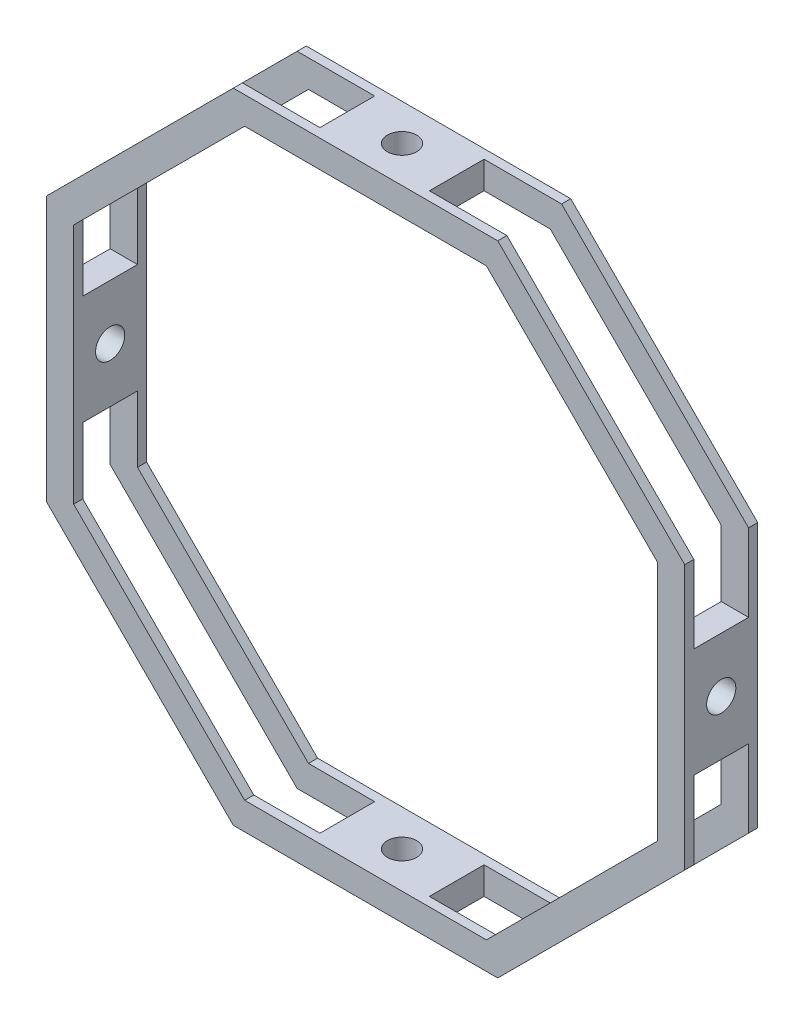
from build123d import *

# Parameters (mm, degrees)
RESSALTO_EXTRUS_O1_DEPTH   = 40
CORTE_EXTRUS_O2_DEPTH      = 394.350988304
CORTE_EXTRUS_O2_DEPTH_BACK = 394.350988304
ESBO_O2_W                  = 30
ESBO_O2_H                  = 42.5
CORTE_EXTRUS_O3_DEPTH      = 394.350988304
CORTE_EXTRUS_O3_DEPTH_BACK = 394.350988304
ESBO_O4_R                  = 8
CORTE_EXTRUS_O4_DEPTH      = 394.350988304
CORTE_EXTRUS_O4_DEPTH_BACK = 394.350988304
ESBO_O2_4_W                = 30
ESBO_O2_4_H                = 42.487373415
CORTE_EXTRUS_O5_DEPTH      = 425.376696692
CORTE_EXTRUS_O5_DEPTH_BACK = 425.376696692
ESBO_O15_W                 = 30
ESBO_O15_H                 = 144.97474683
CORTE_EXTRUS_O6_DEPTH      = 425.376696692
CORTE_EXTRUS_O6_DEPTH_BACK = 425.376696692
ESBO_O16_W                 = 30
ESBO_O16_H                 = 144.97474683
CORTE_EXTRUS_O8_DEPTH      = 394.350988304
CORTE_EXTRUS_O8_DEPTH_BACK = 394.350988304
ESBO_O22_W                 = 42.487373415
ESBO_O22_H                 = 30
CORTE_EXTRUS_O9_DEPTH      = 394.350988304
CORTE_EXTRUS_O9_DEPTH_BACK = 394.350988304
ESBO_O23_R                 = 8


with BuildPart() as part:
    # Esboço1 → Ressalto-extrusão1 (new body)
    with BuildSketch(Plane.XY):
        Polygon((175, 72.487373415), (72.487373415, 175), (-72.487373415, 175), (-175, 72.487373415), (-175, -72.487373415), (-72.487373415, -175), (72.487373415, -175), (175, -72.487373415), align=None)
        Polygon((160, 66.27416998), (66.27416998, 160), (-66.27416998, 160), (-160, 66.27416998), (-160, -66.27416998), (-66.27416998, -160), (66.27416998, -160), (160, -66.27416998), align=None, mode=Mode.SUBTRACT)
    extrude(amount=RESSALTO_EXTRUS_O1_DEPTH)

    # Esboço2 → Corte-extrusão2 (cut, two sides: drawn at the far end of the back side and taken through both)
    with BuildSketch(Plane(origin=(175, 0, 0), x_dir=(0, 0, -1), z_dir=(1, 0, 0)).offset(-CORTE_EXTRUS_O2_DEPTH_BACK)):
        with Locations((-20, 51.237373415)):
            Rectangle(ESBO_O2_W, ESBO_O2_H)
    extrude(amount=CORTE_EXTRUS_O2_DEPTH + CORTE_EXTRUS_O2_DEPTH_BACK, mode=Mode.SUBTRACT)

    # Esboço4 → Corte-extrusão3 (cut, two sides: drawn at the far end of the back side and taken through both)
    with BuildSketch(Plane(origin=(175, 0, 0), x_dir=(0, 0, -1), z_dir=(1, 0, 0)).offset(-CORTE_EXTRUS_O3_DEPTH_BACK)):
        with Locations((-20, 0)):
            Circle(ESBO_O4_R)
    extrude(amount=CORTE_EXTRUS_O3_DEPTH + CORTE_EXTRUS_O3_DEPTH_BACK, mode=Mode.SUBTRACT)

    # Esboço2<4> → Corte-extrusão4 (cut, two sides: drawn at the far end of the back side and taken through both)
    with BuildSketch(Plane(origin=(175, 0, 0), x_dir=(0, 0, -1), z_dir=(1, 0, 0)).offset(-CORTE_EXTRUS_O4_DEPTH_BACK)):
        with Locations((-20, -51.243686708)):
            Rectangle(ESBO_O2_4_W, ESBO_O2_4_H)
    extrude(amount=CORTE_EXTRUS_O4_DEPTH + CORTE_EXTRUS_O4_DEPTH_BACK, mode=Mode.SUBTRACT)

    # Esboço15 → Corte-extrusão5 (cut, two sides: drawn at the far end of the back side and taken through both)
    with BuildSketch(Plane(origin=(-123.743686708, 123.743686708, 0), x_dir=(0, 0, 1), z_dir=(-0.7071067811865486, 0.7071067811865465, 0)).offset(-CORTE_EXTRUS_O5_DEPTH_BACK)):
        with Locations((20, 0)):
            Rectangle(ESBO_O15_W, ESBO_O15_H)
    extrude(amount=CORTE_EXTRUS_O5_DEPTH + CORTE_EXTRUS_O5_DEPTH_BACK, mode=Mode.SUBTRACT)

    # Esboço16 → Corte-extrusão6 (cut, two sides: drawn at the far end of the back side and taken through both)
    with BuildSketch(Plane(origin=(123.743686708, 123.743686708, 0), x_dir=(0, 0, -1), z_dir=(0.7071067811865465, 0.7071067811865487, 0)).offset(-CORTE_EXTRUS_O6_DEPTH_BACK)):
        with Locations((-20, 0)):
            Rectangle(ESBO_O16_W, ESBO_O16_H)
    extrude(amount=CORTE_EXTRUS_O6_DEPTH + CORTE_EXTRUS_O6_DEPTH_BACK, mode=Mode.SUBTRACT)

    # Esboço22 → Corte-extrusão8 (cut, two sides: drawn at the far end of the back side and taken through both)
    with BuildSketch(Plane(origin=(0, 175, 0), x_dir=(1, 0, 0), z_dir=(0, 1, 0)).offset(-CORTE_EXTRUS_O8_DEPTH_BACK)):
        with Locations((-51.243686708, -20)):
            Rectangle(ESBO_O22_W, ESBO_O22_H)
        with Locations((51.243686708, -20)):
            Rectangle(ESBO_O22_W, ESBO_O22_H)
    extrude(amount=CORTE_EXTRUS_O8_DEPTH + CORTE_EXTRUS_O8_DEPTH_BACK, mode=Mode.SUBTRACT)

    # Esboço23 → Corte-extrusão9 (cut, two sides: drawn at the far end of the back side and taken through both)
    with BuildSketch(Plane(origin=(0, 175, 0), x_dir=(1, 0, 0), z_dir=(0, 1, 0)).offset(-CORTE_EXTRUS_O9_DEPTH_BACK)):
        with Locations((0, -20)):
            Circle(ESBO_O23_R)
    extrude(amount=CORTE_EXTRUS_O9_DEPTH + CORTE_EXTRUS_O9_DEPTH_BACK, mode=Mode.SUBTRACT)


solid = part.part
